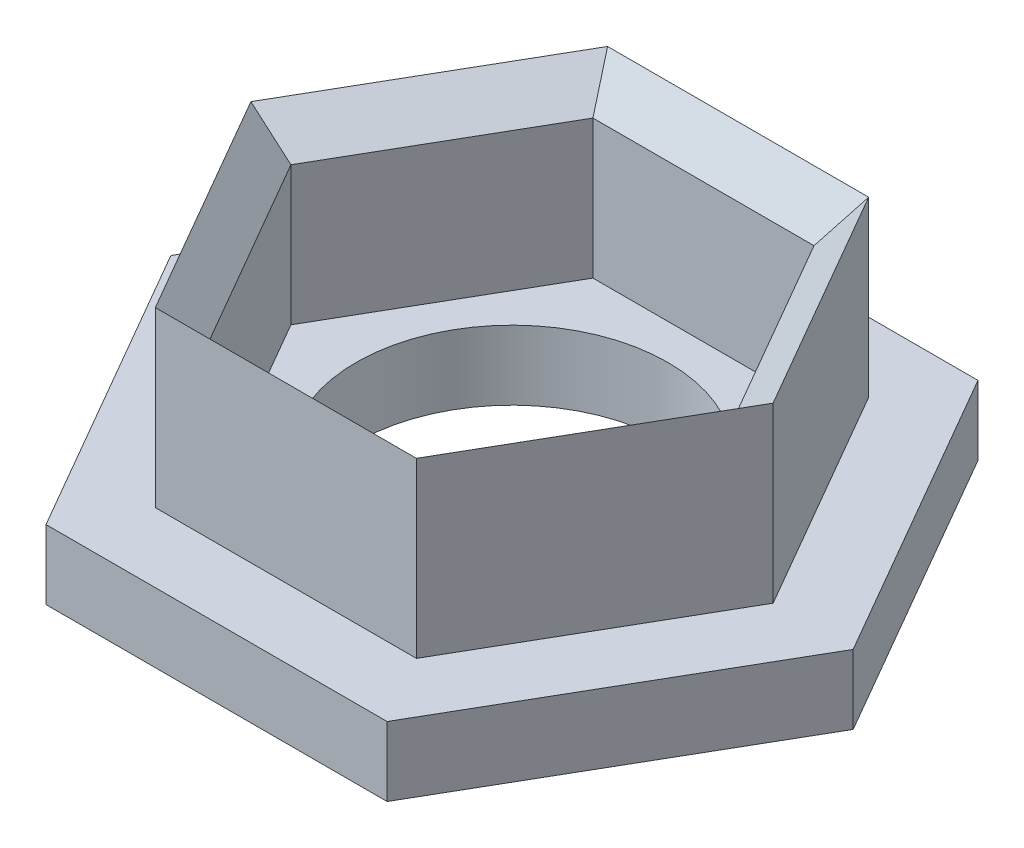
from build123d import *

# Parameters (mm, degrees)
SKETCH2_R           = 4.5
BOSS_EXTRUDE1_DEPTH = 2
BOSS_EXTRUDE2_DEPTH = 5
CHAMFER1_SIZE       = 1


with BuildPart() as part:
    # Sketch2 → Boss-Extrude1 (new body)
    with BuildSketch(Plane.XZ):
        Polygon((-4.921911045, -8.525), (4.921911045, -8.525), (9.84382209, 0), (4.921911045, 8.525), (-4.921911045, 8.525), (-9.84382209, 0), align=None)
        with Locations(Location((0, 0, 0), (0, 0, 270))):
            Circle(SKETCH2_R, mode=Mode.SUBTRACT)
    extrude(amount=BOSS_EXTRUDE1_DEPTH)

    # Sketch3 → Boss-Extrude2 (add)
    with BuildSketch(Plane.XZ):
        Polygon((7.534421013, 0), (3.767210506, 6.525), (-3.767210506, 6.525), (-7.534421013, 0), (-3.767210506, -6.525), (3.767210506, -6.525), align=None)
        Polygon((3.189860237, 5.525), (-3.189860237, 5.525), (-6.379720475, 0), (-3.189860237, -5.525), (3.189860237, -5.525), (6.379720475, 0), align=None, mode=Mode.SUBTRACT)
    extrude(amount=-BOSS_EXTRUDE2_DEPTH)

    # Chamfer1
    chamfer1_edges = [part.edges().sort_by_distance(p)[0] for p in [
        (4.784790356, 5, -2.7625),
        (4.784790356, 5, 2.7625),
        (0, 5, 5.525),
        (-4.784790356, 5, 2.7625),
        (-4.784790356, 5, -2.7625),
        (0, 5, -5.525),
    ]]
    chamfer(chamfer1_edges, length=CHAMFER1_SIZE - 0.0001)  # a hair under: the kernel refuses the full size


solid = part.part
